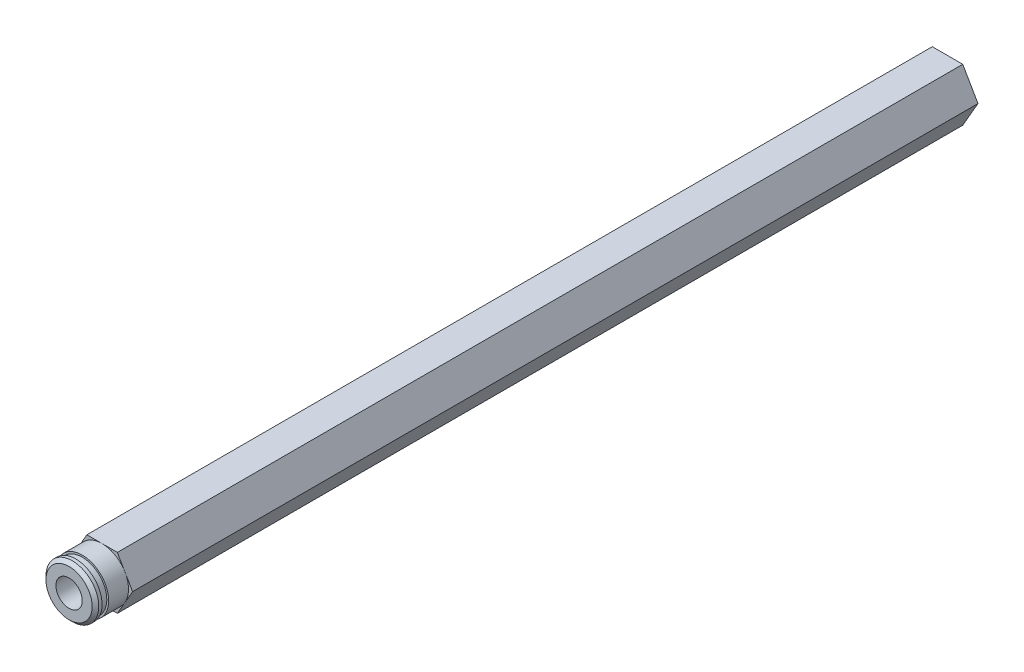
from build123d import *

# Parameters (mm, degrees)
EXTRUSI_N_HEX_PROFILE_DEPTH = 105.640650034
CROQUIS13_R                 = 3.16865
CORTAR_EXTRUIR1_DEPTH       = 7.62


with BuildPart() as part:
    # Croquis2 → Extrusión Hex Profile (new, symmetric)
    with BuildSketch(Plane.XY):
        Polygon((3.666174209, -6.35), (7.332348419, 0), (3.666174209, 6.35), (-3.666174209, 6.35), (-7.332348419, 0), (-3.666174209, -6.35), align=None)
    extrude(amount=EXTRUSI_N_HEX_PROFILE_DEPTH, both=True)

    # Croquis8 → Retaining Ring 1 (revolve, cut)
    with BuildSketch(Plane(origin=(0, 0, 0), x_dir=(1, 0, 0), z_dir=(0, 1, 0))):
        Polygon((-5.55625, -105.640650034), (-6.35, -104.846900034), (-6.35, -104.053150034), (-5.9055, -104.053150034), (-5.9055, -102.465650034), (-12.7, -102.465650034), (-12.7, -105.640650034), align=None)
    revolve(axis=Axis((0, 0, 105.640650034), (0, 0, -1)), mode=Mode.SUBTRACT)

    # Croquis10 → Round End 1 (revolve, cut)
    with BuildSketch(Plane(origin=(0, 0, 0), x_dir=(1, 0, 0), z_dir=(0, 1, 0))):
        Polygon((-5.55625, -105.640650034), (-6.35, -104.846900034), (-6.35, -97.690450034), (-9.525, -97.690450034), (-9.525, -105.640650034), align=None)
    revolve(axis=Axis((0, 0, 105.640650034), (0, 0, -1)), mode=Mode.SUBTRACT)

    # Croquis13 → Cortar-Extruir1 (cut)
    with BuildSketch(Plane.XY.offset(105.640650034)):
        Circle(CROQUIS13_R)
    extrude(amount=-CORTAR_EXTRUIR1_DEPTH, mode=Mode.SUBTRACT)


solid = part.part
